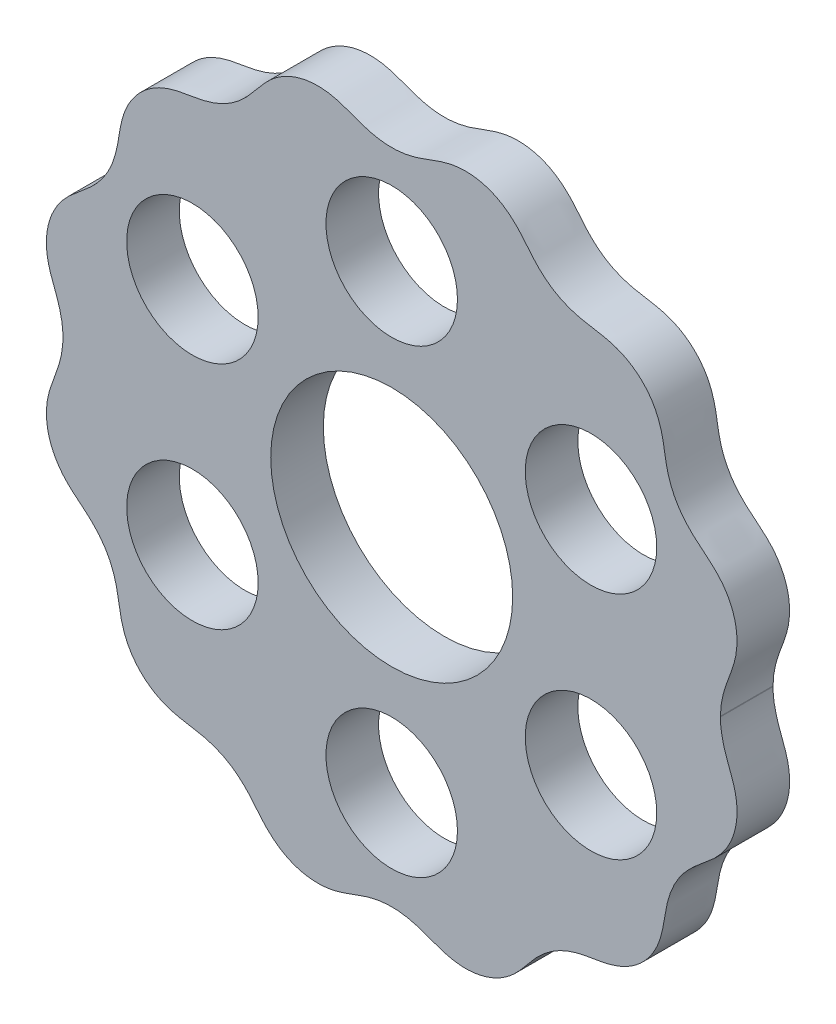
from build123d import *

# Parameters (mm, degrees)
SKETCH3_R           = 9.2
SKETCH3_R_2         = 5
BOSS_EXTRUDE2_DEPTH = 4


with BuildPart() as part:
    # Sketch3 → Boss-Extrude2 (new body)
    with BuildSketch(Plane.XY):
        with BuildLine():
            add(Edge.make_bspline(
                [(25, 0), (25, -0.028419379), (25.000492821, -0.085240091), (25.002710517, -0.186096381), (25.008616202, -0.331732724), (25.017454216, -0.471095426), (25.029199756, -0.604110594), (25.043819456, -0.735775062), (25.0612711, -0.868216065), (25.086561311, -1.034185241), (25.122348392, -1.232409452), (25.171720804, -1.461619521), (25.23785416, -1.72161835), (25.33146082, -2.043525868), (25.437671669, -2.361532194), (25.552791346, -2.676356937), (25.69530689, -3.052450734), (25.837320412, -3.428807717), (26.007461604, -3.919608843), (26.169082038, -4.536352918), (26.29301302, -5.400577617), (26.248865742, -6.509268079), (25.900590468, -7.758927573), (25.250933039, -8.824024045), (24.559448754, -9.548775191), (23.872924134, -10.132867754), (23.242034799, -10.633504856), (22.540451444, -11.262027255), (21.859772382, -12.093532725), (21.337087227, -13.027141562), (20.986474338, -14.032216693), (20.783152218, -15.069054613), (20.629229677, -16.210615672), (20.295790024, -17.423577203), (19.620081418, -18.614367157), (18.57817853, -19.648167397), (17.377311503, -20.316253266), (16.151486918, -20.639994045), (14.739949908, -20.826544524), (13.439402762, -21.1258531), (12.23711891, -21.731124361), (11.217263285, -22.586282659), (10.510510486, -23.382376891), (9.803864636, -24.301158332), (8.912502074, -25.202295013), (7.731407454, -25.911659846), (6.309337856, -26.299864083), (4.931582798, -26.288472232), (3.706115601, -25.964583322), (2.633674004, -25.522967435), (1.62667227, -25.181750578), (0.581426656, -24.989102643), (-0.478930933, -24.980713481), (-1.520966388, -25.154635937), (-2.520449471, -25.479461333), (-3.419229104, -25.84785235), (-4.274357012, -26.11935553), (-5.084141891, -26.255225085), (-5.827195666, -26.277840049), (-6.751118437, -26.176673588), (-7.819413481, -25.850368791), (-8.864535557, -25.241992085), (-9.774472842, -24.337578456), (-10.489042176, -23.409443312), (-11.198070814, -22.604475083), (-12.019349647, -21.910802096), (-12.950687048, -21.371323607), (-13.961150534, -21.004447957), (-15.012542859, -20.790681073), (-16.17349347, -20.636604415), (-17.412795128, -20.30409628), (-18.621589199, -19.617234196), (-19.535225069, -18.69087907), (-20.109505434, -17.744490957), (-20.468260184, -16.811352879), (-20.669325741, -15.929542243), (-20.800368009, -14.951283195), (-21.021499046, -13.897450049), (-21.399469544, -12.891789727), (-21.945671579, -11.971536034), (-22.639598338, -11.164500934), (-23.435367487, -10.469229858), (-24.347111984, -9.765350187), (-25.232158972, -8.871517572), (-25.925709908, -7.694669196), (-26.301679816, -6.282910402), (-26.285367064, -4.916976266), (-25.96232166, -3.701401982), (-25.524214021, -2.636206013), (-25.184526072, -1.63546138), (-24.98964456, -0.589100982), (-24.979676648, 0.481005828), (-25.157831343, 1.540454587), (-25.495205931, 2.562927815), (-25.870736407, 3.4757204), (-26.135455064, 4.34059116), (-26.288515222, 5.328583568), (-26.261093111, 6.43001327), (-25.933564455, 7.678441647), (-25.237701394, 8.866637346), (-24.34504384, 9.767557339), (-23.427022399, 10.47557852), (-22.62699323, 11.1763696), (-21.936896568, 11.984292454), (-21.397747575, 12.897748952), (-21.026718925, 13.886522177), (-20.806135146, 14.914602211), (-20.653045268, 16.060286336), (-20.395622874, 17.11611043), (-19.95690194, 18.028441349), (-19.300149626, 18.928757994), (-18.483671803, 19.692277913), (-17.435839429, 20.294614033), (-16.197622229, 20.632400397), (-15.036829757, 20.787344769), (-13.984887122, 20.997904882), (-12.973147938, 21.361026229), (-12.039474616, 21.896555136), (-11.215678135, 22.58716662), (-10.504008287, 23.390162439), (-9.790282182, 24.318640694), (-8.884052218, 25.226941722), (-7.685868846, 25.932204762), (-6.427337904, 26.262197332), (-5.32062142, 26.288060185), (-4.332905845, 26.133623194), (-3.468339345, 25.867884001), (-2.55560208, 25.492296977), (-1.532755887, 25.155882506), (-0.473083435, 24.979033961), (0.597006536, 24.990441303), (1.643127458, 25.186582226), (2.643510183, 25.527172752), (3.708827205, 25.965063812), (4.924909383, 26.286396603), (6.29085556, 26.300692327), (7.702048601, 25.922603812), (8.877880267, 25.227310889), (9.770417048, 24.341030317), (10.474070774, 23.429151565), (11.170105737, 22.633979321), (11.977973527, 21.941022037), (12.898969216, 21.396054985), (13.905080963, 21.019330701), (14.959093015, 20.79921578), (15.93734026, 20.668117182), (16.818953838, 20.466007301), (17.751576334, 20.105941467), (18.697120313, 19.53023506), (19.622089623, 18.615234931), (20.307180817, 17.405403853), (20.637904711, 16.165690953), (20.791787115, 15.004742729), (21.00656033, 13.953487), (21.374668771, 12.943487437), (21.915401419, 12.012841988), (22.610070929, 11.192473379), (23.415648604, 10.48411951), (24.343684699, 9.769551905), (25.246796647, 8.857951736), (25.940942688, 7.662077141), (26.262511444, 6.413848041), (26.28479299, 5.412288327), (26.191439435, 4.704296235), (26.088108997, 4.226630913), (25.967232391, 3.802316147), (25.80790495, 3.345695262), (25.619629464, 2.855327013), (25.458833672, 2.424502992), (25.333860765, 2.050706314), (25.241721849, 1.735435761), (25.176361339, 1.480873774), (25.120257899, 1.224415288), (25.074119122, 0.965148365), (25.038505918, 0.70465122), (25.016960864, 0.482504301), (25.005267885, 0.264321243), (25.00135895, 0.133217809), (25.000430803, 0.077544036), (25.000203175, 0.049701947)],
                knots=[0.076056741, 0.076056741, 0.076056741, 0.076056741, 0.076056741, 0.076716626, 0.077376511, 0.078036395, 0.07869628, 0.079356165, 0.080016049, 0.080675934, 0.081335819, 0.082655588, 0.083975357, 0.085295127, 0.086614896, 0.089254435, 0.090574204, 0.091893973, 0.094533512, 0.097173051, 0.100798473, 0.104423896, 0.11167474, 0.118848356, 0.126021971, 0.128665019, 0.131308067, 0.136594162, 0.141880258, 0.147166354, 0.152357566, 0.157548778, 0.16273999, 0.167931202, 0.175042017, 0.182152833, 0.189326507, 0.196500181, 0.201723091, 0.206946, 0.217391818, 0.222614771, 0.227837725, 0.233060678, 0.238283631, 0.245457287, 0.252630943, 0.259804707, 0.266978471, 0.272201179, 0.277423888, 0.282646597, 0.287869306, 0.293029544, 0.298189783, 0.303350022, 0.308510261, 0.312159961, 0.315809662, 0.319459363, 0.323109064, 0.330383447, 0.337657831, 0.342925117, 0.348192403, 0.353459689, 0.358726976, 0.363994339, 0.369261702, 0.374529065, 0.379796429, 0.387070764, 0.394345099, 0.401518721, 0.405105533, 0.408692344, 0.413978427, 0.419264509, 0.424550592, 0.429836675, 0.435027902, 0.440219129, 0.445410356, 0.450601583, 0.457712386, 0.464823188, 0.471933966, 0.479044743, 0.484236012, 0.489427281, 0.49461855, 0.499809819, 0.505095864, 0.510381909, 0.515667954, 0.520953999, 0.524540818, 0.528127637, 0.535301275, 0.542475056, 0.549648837, 0.554871514, 0.56009419, 0.565316866, 0.570539542, 0.575699809, 0.580860077, 0.586020345, 0.591180612, 0.598480006, 0.602129703, 0.605779399, 0.613053806, 0.620328213, 0.625595461, 0.630862709, 0.636129958, 0.641397206, 0.646664608, 0.651932009, 0.65719941, 0.662466812, 0.669741122, 0.677015431, 0.684189061, 0.687775877, 0.691362692, 0.696648757, 0.701934822, 0.707220888, 0.712506953, 0.7176982, 0.722889446, 0.728080693, 0.73327194, 0.740382729, 0.747493519, 0.754604309, 0.761715099, 0.766906345, 0.772097591, 0.777288837, 0.782480083, 0.787766149, 0.793052215, 0.798338281, 0.803624347, 0.807211162, 0.810797977, 0.817971607, 0.825245917, 0.832520228, 0.837787628, 0.843055028, 0.848322428, 0.853589828, 0.858857078, 0.864124328, 0.869391577, 0.874658827, 0.881933233, 0.889207639, 0.896231602, 0.899743584, 0.901499575, 0.903255566, 0.905841573, 0.908427581, 0.911013588, 0.913599595, 0.914892599, 0.916185603, 0.917478607, 0.91877161, 0.920064614, 0.921357618, 0.922650621, 0.923297123, 0.923943625, 0.923943625, 0.923943625, 0.923943625, 0.923943625], degree=4))
            Line((25.000203175, 0.049701947), (25, 0))
        make_face()
        Circle(SKETCH3_R, mode=Mode.SUBTRACT)
        with Locations((0, 17.5)):
            Circle(SKETCH3_R_2, mode=Mode.SUBTRACT)
        with Locations((15.155444566, 8.75)):
            Circle(SKETCH3_R_2, mode=Mode.SUBTRACT)
        with Locations((15.155444566, -8.75)):
            Circle(SKETCH3_R_2, mode=Mode.SUBTRACT)
        with Locations((0, -17.5)):
            Circle(SKETCH3_R_2, mode=Mode.SUBTRACT)
        with Locations((-15.155444566, -8.75)):
            Circle(SKETCH3_R_2, mode=Mode.SUBTRACT)
        with Locations((-15.155444566, 8.75)):
            Circle(SKETCH3_R_2, mode=Mode.SUBTRACT)
    extrude(amount=BOSS_EXTRUDE2_DEPTH)


solid = part.part
